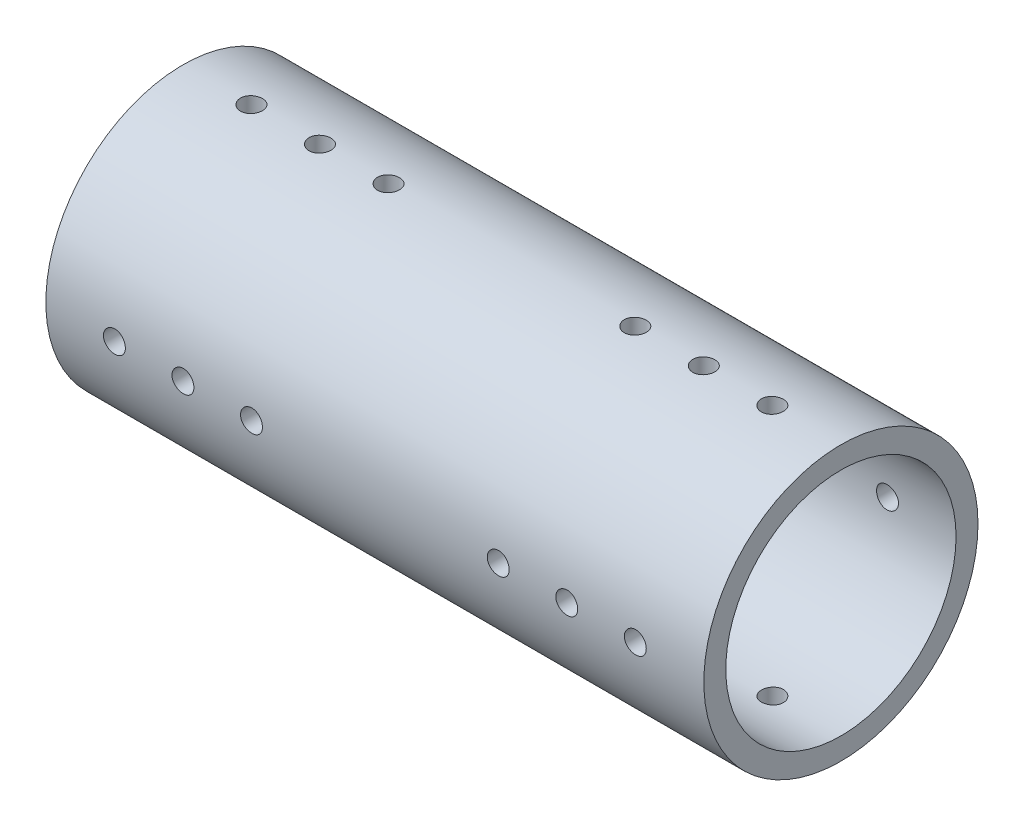
from build123d import *

# Parameters (mm, degrees)
SKETCH_2_R               = 25
SKETCH_2_R_2             = 21
EXTRUDE_2_DEPTH          = 120
CUT_EXTRUDE_START        = -133.382022949
SKETCH_4_R               = 2
CUT_EXTRUDE_2_DEPTH      = 143.382022949
PATTERN_CIRCULAR_1_COUNT = 4


with BuildPart() as part:
    # Эскиз2 → Бобышка-Вытянуть2 (new body)
    with BuildSketch(Plane(origin=(0, 0, 0), x_dir=(0, 0, -1), z_dir=(1, 0, 0))):
        Circle(SKETCH_2_R)
        Circle(SKETCH_2_R_2, mode=Mode.SUBTRACT)
    extrude(amount=EXTRUDE_2_DEPTH)

    # Эскиз4 → Вырез-Вытянуть2 (cut)
    with BuildSketch(Plane.XY.offset(25).offset(CUT_EXTRUDE_START)):
        with Locations((12.5, 0)):
            Circle(SKETCH_4_R)
        with Locations((107.5, 0)):
            Circle(SKETCH_4_R)
        with Locations((25, 0)):
            Circle(SKETCH_4_R)
        with Locations((37.5, 0)):
            Circle(SKETCH_4_R)
        with Locations((95, 0)):
            Circle(SKETCH_4_R)
        with Locations((82.5, 0)):
            Circle(SKETCH_4_R)
    cut_extrude_2 = extrude(amount=CUT_EXTRUDE_2_DEPTH, mode=Mode.SUBTRACT)

    # Круговой массив1: Вырез-Вытянуть2 ×4 about axis
    pattern_circular_1_axis = Axis((120, 0, 0), (-1, 0, 0))
    for i in range(1, PATTERN_CIRCULAR_1_COUNT):
        add(cut_extrude_2.rotate(pattern_circular_1_axis, i * 360 / PATTERN_CIRCULAR_1_COUNT), mode=Mode.SUBTRACT)


solid = part.part
